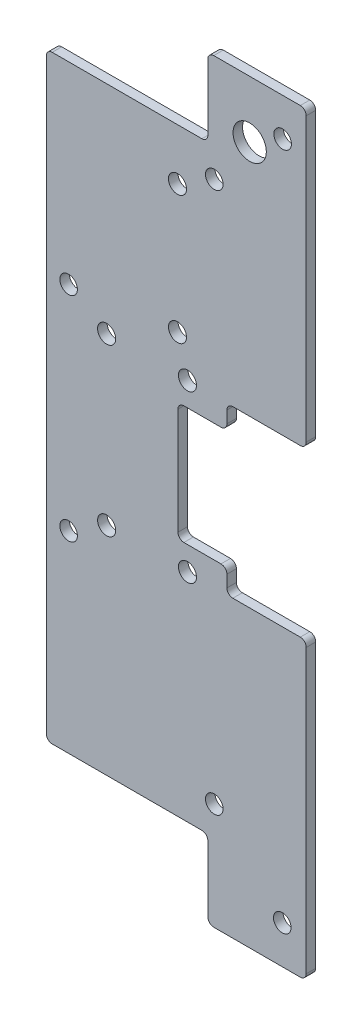
from build123d import *

# Parameters (mm, degrees)
SKETCH1_R               = 2.3495
SKETCH1_R_2             = 4.445
BOSS_EXTRUDE1_DEPTH     = 2.54
SKETCH2_R               = 2.413
CUT_EXTRUDE1_DEPTH      = 217.884748371
SKETCH3_W               = 13.08488816
SKETCH3_H               = 31.623
CUT_EXTRUDE2_DEPTH      = 217.884748371
SKETCH4_W               = 12.77569874
SKETCH4_H               = 24.435209008
SKETCH4_W_2             = 40.233428475
SKETCH4_H_2             = 28.333759116
CUT_EXTRUDE3_DEPTH      = 217.884748371
SKETCH5_R               = 2.413
CUT_EXTRUDE4_DEPTH      = 217.884748371
CUT_EXTRUDE5_DEPTH      = 217.884748371
CUT_EXTRUDE5_DEPTH_BACK = 217.884748371
SKETCH8_R               = 2.3495
CUT_EXTRUDE6_DEPTH      = 191.226610272
FILLET1_R               = 1.5875
SKETCH9_W               = 0.38488816
SKETCH9_H               = 2.54
CUT_EXTRUDE7_DEPTH      = 152.146866512


with BuildPart() as part:
    # Sketch1 → Boss-Extrude1 (new body)
    with BuildSketch(Plane.XY):
        Polygon((-2.930050059, -104.509781075), (-3.314938219, -104.509781075), (-3.314938219, -110.859781075), (-3.314938219, -123.559781075), (-2.930050059, -123.559781075), (-2.930050059, -168.708281075), (38.709428475, -168.708281075), (38.709428475, -189.536281075), (105.397061781, -189.536281075), (66.517436481, -110.859781075), (45.329949941, -110.859781075), (45.329949941, -104.509781075), (45.329949941, -72.886781075), (45.329949941, -66.536781075), (66.517436481, -66.536781075), (105.397061781, 12.139718925), (38.709428475, 12.139718925), (38.709428475, -8.688281075), (-2.930050059, -8.688281075), (-2.930050059, -53.836781075), (-3.314938219, -53.836781075), (-3.314938219, -66.536781075), (-3.314938219, -72.886781075), (-2.930050059, -72.886781075), align=None)
        with Locations((90.673911143, 2.614718925)):
            Circle(SKETCH1_R, mode=Mode.SUBTRACT)
        with Locations((41.95655448, -16.435281075)):
            Circle(SKETCH1_R, mode=Mode.SUBTRACT)
        with Locations((3.035061781, -60.186781075)):
            Circle(SKETCH1_R, mode=Mode.SUBTRACT)
        with Locations((3.035061781, -117.209781075)):
            Circle(SKETCH1_R, mode=Mode.SUBTRACT)
        with Locations((41.95655448, -160.961281075)):
            Circle(SKETCH1_R, mode=Mode.SUBTRACT)
        with Locations((90.673911143, -180.011281075)):
            Circle(SKETCH1_R, mode=Mode.SUBTRACT)
        with Locations((51.409428475, -3.100281075)):
            Circle(SKETCH1_R_2, mode=Mode.SUBTRACT)
    extrude(amount=BOSS_EXTRUDE1_DEPTH)

    # Sketch2 → Cut-Extrude1 (cut, through all)
    with BuildSketch(Plane.XY.offset(2.54)):
        with Locations((13.195061781, -66.536781075)):
            Circle(SKETCH2_R)
        with Locations((34.785061781, -66.536781075)):
            Circle(SKETCH2_R)
        with Locations((34.785061781, -110.859781075)):
            Circle(SKETCH2_R)
        with Locations((13.195061781, -110.859781075)):
            Circle(SKETCH2_R)
    extrude(amount=-CUT_EXTRUDE1_DEPTH, mode=Mode.SUBTRACT)

    # Sketch3 → Cut-Extrude2 (cut, through all)
    with BuildSketch(Plane.XY.offset(2.54)):
        with Locations((38.787505861, -88.698281075)):
            Rectangle(SKETCH3_W, SKETCH3_H)
    extrude(amount=-CUT_EXTRUDE2_DEPTH, mode=Mode.SUBTRACT)

    # Sketch4 → Cut-Extrude3 (cut, through all)
    with BuildSketch(Plane.XY.offset(2.54)):
        with Locations((33.845579105, 3.529323429)):
            Rectangle(SKETCH4_W, SKETCH4_H)
        with Locations((20.116714238, -182.875160633)):
            Rectangle(SKETCH4_W_2, SKETCH4_H_2)
    extrude(amount=-CUT_EXTRUDE3_DEPTH, mode=Mode.SUBTRACT)

    # Sketch5 → Cut-Extrude4 (cut, through all)
    with BuildSketch(Plane(origin=(0, 0, 0), x_dir=(-1, 0, 0), z_dir=(0, 0, -1))):
        with Locations((-32.121949941, -22.404281075)):
            Circle(SKETCH5_R)
        with Locations((-32.121949941, -56.694281075)):
            Circle(SKETCH5_R)
    extrude(amount=-CUT_EXTRUDE4_DEPTH, mode=Mode.SUBTRACT)

    # Sketch7 → Cut-Extrude5 (cut, two sides: drawn at the far end of the back side and taken through both)
    with BuildSketch(Plane.XY.offset(2.54).offset(-CUT_EXTRUDE5_DEPTH_BACK)):
        Polygon((66.517436481, -66.536781075), (66.517436481, 21.52212206), (127.820808625, 21.52212206), (115.78217236, -200.256310461), (66.517436481, -200.256310461), (66.517436481, -110.859781075), align=None)
    extrude(amount=CUT_EXTRUDE5_DEPTH + CUT_EXTRUDE5_DEPTH_BACK, mode=Mode.SUBTRACT)

    # Sketch8 → Cut-Extrude6 (cut, through all)
    with BuildSketch(Plane(origin=(13.551580143, -170.546705634, 0), x_dir=(0.9999106684671756, -0.013366191885727564, 0), z_dir=(0, 0, -1))):
        with Locations((44.353535624, -173.175566882)):
            Circle(SKETCH8_R)
        with Locations((46.68181957, 8.1642617)):
            Circle(SKETCH8_R)
    extrude(amount=-CUT_EXTRUDE6_DEPTH, mode=Mode.SUBTRACT)

    # Fillet1
    fillet1_edges = [part.edges().sort_by_distance(p)[0] for p in [
        (-2.930050059, -168.708281075, 1.27),
        (40.233428475, -168.708281075, 1.27),
        (40.233428475, -189.536281075, 1.27),
        (66.517436481, -189.536281075, 1.27),
        (66.517436481, -110.859781075, 1.27),
        (45.329949941, -110.859781075, 1.27),
        (45.329949941, -104.509781075, 1.27),
        (32.245061781, -104.509781075, 1.27),
        (32.245061781, -72.886781075, 1.27),
        (45.329949941, -72.886781075, 1.27),
        (45.329949941, -66.536781075, 1.27),
        (66.517436481, -66.536781075, 1.27),
        (66.517436481, 12.139718925, 1.27),
        (40.233428475, 12.139718925, 1.27),
        (40.233428475, -8.688281075, 1.27),
        (-2.930050059, -8.688281075, 1.27),
    ]]
    fillet(fillet1_edges, radius=FILLET1_R)

    # Sketch9 → Cut-Extrude7 (cut, through all)
    with BuildSketch(Plane.XZ.offset(123.559781075)):
        with Locations((-3.122494139, 1.27)):
            Rectangle(SKETCH9_W, SKETCH9_H)
    extrude(amount=-CUT_EXTRUDE7_DEPTH, mode=Mode.SUBTRACT)


solid = part.part
